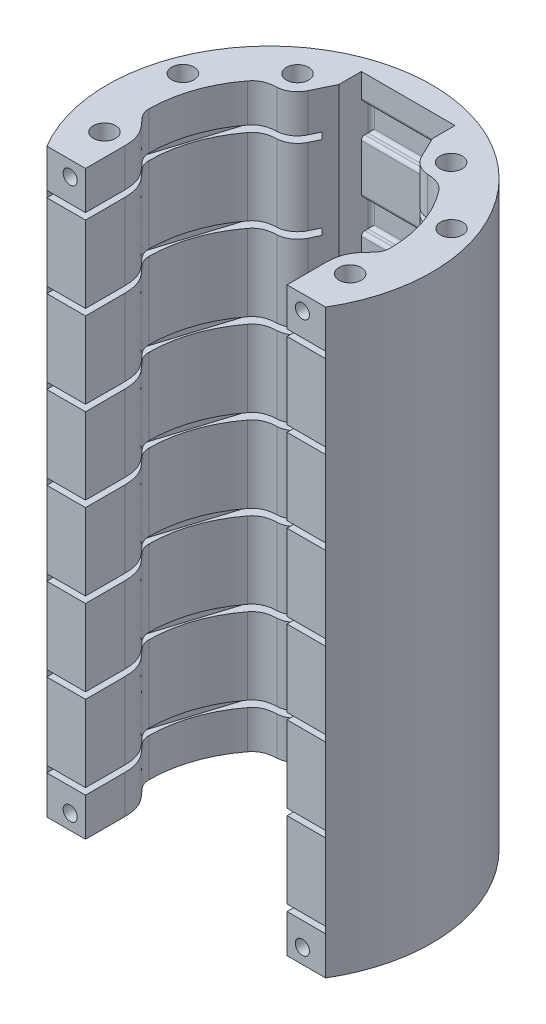
from build123d import *

# Parameters (mm, degrees)
SKETCH1_R               = 3.35
BOSS_EXTRUDE2_DEPTH     = 175
SLOT_DEPTH              = 0.975
SKETCH2_W               = 28.2
SKETCH2_H               = 9.048762348
CUT_EXTRUDE1_DEPTH      = 3
FILLET1_R               = 1
LPATTERN1_COUNT         = 7
LPATTERN1_PITCH         = 25
FILLET1_OF_LPATTERN1_R  = 1
SKETCH7_R               = 2.125
CUT_EXTRUDE2_DEPTH      = 8
MIRROR2_COPY_1_SKETCH_R = 2.125
MIRROR2_COPY_1_DEPTH    = 8


with BuildPart() as part:
    # Sketch1 → Boss-Extrude2 (new body)
    with BuildSketch(Plane(origin=(0, 0, 0), x_dir=(1, 0, 0), z_dir=(0, 1, 0))):
        with BuildLine():
            Line((-41.978758021, -25.07), (-30.348758021, -25.07))
            Line((-30.348758021, -25.07), (-30.348758021, -13.232808954))
            add(Edge.make_bspline(
                [(-30.348758021, -13.232808954), (-30.348758021, -4.818714921), (-36.33, -4.744134389), (-36.33, 0)],
                knots=[0, 0, 0, 0, 1, 1, 1, 1], degree=3))
            ThreePointArc((-36.33, 0), (-34.39042699, 11.711850043), (-28.778806418, 22.173163986))
            add(Edge.make_bspline(
                [(-28.778806418, 22.173163986), (-26.803037595, 24.859102931), (-22.681011433, 24.921676571)],
                knots=[0, 0, 0, 1, 1, 1], degree=2))
            ThreePointArc((-22.681011433, 24.921676571), (-19.402847958, 26.048993856), (-17.137442499, 28.672948531))
            Line((-17.137442499, 28.672948531), (-14.1, 34.984991814))
            Line((-14.1, 34.984991814), (-14.1, 41.76))
            Line((-14.1, 41.76), (14.1, 41.76))
            Line((14.1, 41.76), (14.1, 34.984991814))
            Line((14.1, 34.984991814), (17.137442499, 28.672948531))
            ThreePointArc((17.137442499, 28.672948531), (19.402847958, 26.048993856), (22.681011433, 24.921676571))
            add(Edge.make_bspline(
                [(28.778806418, 22.173163986), (26.803037595, 24.859102931), (22.681011433, 24.921676571)],
                knots=[0, 0, 0, 1, 1, 1], degree=2))
            ThreePointArc((28.778806418, 22.173163986), (34.39042699, 11.711850043), (36.33, 0))
            add(Edge.make_bspline(
                [(30.348758021, -13.232808954), (30.348758021, -4.818714921), (36.33, -4.744134389), (36.33, 0)],
                knots=[0, 0, 0, 0, 1, 1, 1, 1], degree=3))
            Line((30.348758021, -13.232808954), (30.348758021, -25.07))
            Line((30.348758021, -25.07), (41.978758021, -25.07))
            ThreePointArc((41.978758021, -25.07), (0, 48.895), (-41.978758021, -25.07))
        make_face()
        with Locations((-37.000474826, -12.718618748)):
            Circle(SKETCH1_R, mode=Mode.SUBTRACT)
        with Locations((37.000474826, -12.718618748)):
            Circle(SKETCH1_R, mode=Mode.SUBTRACT)
        with Locations((-40.457027923, 14.360145949)):
            Circle(SKETCH1_R, mode=Mode.SUBTRACT)
        with Locations((-23.129730363, 31.556520301)):
            Circle(SKETCH1_R, mode=Mode.SUBTRACT)
        with Locations((40.457027923, 14.360145949)):
            Circle(SKETCH1_R, mode=Mode.SUBTRACT)
        with Locations((23.129730363, 31.556520301)):
            Circle(SKETCH1_R, mode=Mode.SUBTRACT)
    extrude(amount=BOSS_EXTRUDE2_DEPTH)

    # Sketch6 → slot (cut, symmetric)
    with BuildSketch(Plane(origin=(0, 12.5, 0), x_dir=(-1, 0, 0), z_dir=(0, -1, 0))):
        with BuildLine():
            Line((41.978758021, -25.07), (42.348021617, -12.880616636))
            ThreePointArc((42.348021617, -12.880616636), (42.300596018, -11.989773536), (42.105800179, -11.119196027))
            Line((42.105800179, -11.119196027), (28.235055716, 33.155943022))
            ThreePointArc((28.235055716, 33.155943022), (24.341289072, 36.767530328), (19.253636812, 35.244120983))
            Line((19.253636812, 35.244120983), (13.047964359, 28.721243631))
            ThreePointArc((13.047964359, 28.721243631), (12.816725989, 28.560405037), (12.540811932, 28.50373344))
            Line((12.540811932, 28.50373344), (10.657647051, 28.50373344))
            ThreePointArc((10.657647051, 28.50373344), (10.516225695, 28.562312083), (10.457647051, 28.70373344))
            Line((10.457647051, 28.70373344), (10.457647051, 36.268969967))
            Line((10.457647051, 36.268969967), (9.766617018, 36.96))
            Line((9.766617018, 36.96), (-0.68191112, 36.96))
            Line((-0.68191112, 36.96), (-1.357647051, 36.284264069))
            Line((-1.357647051, 36.284264069), (-1.357647051, 29.218375638))
            ThreePointArc((-1.357647051, 29.218375638), (-2.007647051, 28.607259567), (-2.657647051, 29.218375638))
            Line((-2.657647051, 29.218375638), (-2.657647051, 36.284264069))
            Line((-2.657647051, 36.284264069), (-3.333382982, 36.96))
            Line((-3.333382982, 36.96), (-9.78191112, 36.96))
            Line((-9.78191112, 36.96), (-10.457647051, 36.284264069))
            Line((-10.457647051, 36.284264069), (-10.457647051, 28.70373344))
            ThreePointArc((-10.457647051, 28.70373344), (-10.516225695, 28.562312083), (-10.657647051, 28.50373344))
            Line((-10.657647051, 28.50373344), (-12.540811932, 28.50373344))
            ThreePointArc((-12.540811932, 28.50373344), (-12.816725989, 28.560405037), (-13.047964359, 28.721243631))
            Line((-13.047964359, 28.721243631), (-19.253636812, 35.244120983))
            ThreePointArc((-19.253636812, 35.244120983), (-24.341289072, 36.767530328), (-28.235055716, 33.155943022))
            Line((-28.235055716, 33.155943022), (-42.105800179, -11.119196027))
            ThreePointArc((-42.105800179, -11.119196027), (-42.300596018, -11.989773536), (-42.348021617, -12.880616636))
            Line((-42.348021617, -12.880616636), (-41.978758021, -25.07))
            Line((-41.978758021, -25.07), (41.978758021, -25.07))
        make_face()
    slot = extrude(amount=SLOT_DEPTH, both=True, mode=Mode.SUBTRACT)

    # Sketch2 → Cut-Extrude1 (cut)
    with BuildSketch(Plane.XY.offset(-41.76)):
        with Locations((0, 12.5)):
            Rectangle(SKETCH2_W, SKETCH2_H)
    cut_extrude1 = extrude(amount=-CUT_EXTRUDE1_DEPTH, mode=Mode.SUBTRACT)

    # Fillet1
    fillet1_edges = [part.edges().sort_by_distance(p)[0] for p in [
        (0, 17.024381174, -44.76),
        (14.1, 12.5, -44.76),
        (0, 7.975618826, -44.76),
        (-14.1, 12.5, -44.76),
        (0, 7.975618826, -41.76),
        (0, 17.024381174, -41.76),
    ]]
    fillet(fillet1_edges, radius=FILLET1_R)

    # LPattern1: slot, Cut-Extrude1 ×7
    with Locations(*[(0, i * LPATTERN1_PITCH, 0) for i in range(1, LPATTERN1_COUNT)]):
        add(slot, mode=Mode.SUBTRACT)
        add(cut_extrude1, mode=Mode.SUBTRACT)

    # Fillet1 of LPattern1
    fillet1_of_lpattern1_edges = [part.edges().sort_by_distance(p)[0] for p in [
        (0, 42.024381174, -44.76),
        (14.1, 37.5, -44.76),
        (0, 32.975618826, -44.76),
        (-14.1, 37.5, -44.76),
        (0, 32.975618826, -41.76),
        (0, 42.024381174, -41.76),
        (0, 67.024381174, -44.76),
        (14.1, 62.5, -44.76),
        (0, 57.975618826, -44.76),
        (-14.1, 62.5, -44.76),
        (0, 57.975618826, -41.76),
        (0, 67.024381174, -41.76),
        (0, 92.024381174, -44.76),
        (14.1, 87.5, -44.76),
        (0, 82.975618826, -44.76),
        (-14.1, 87.5, -44.76),
        (0, 82.975618826, -41.76),
        (0, 92.024381174, -41.76),
        (0, 117.024381174, -44.76),
        (14.1, 112.5, -44.76),
        (0, 107.975618826, -44.76),
        (-14.1, 112.5, -44.76),
        (0, 107.975618826, -41.76),
        (0, 117.024381174, -41.76),
        (0, 142.024381174, -44.76),
        (14.1, 137.5, -44.76),
        (0, 132.975618826, -44.76),
        (-14.1, 137.5, -44.76),
        (0, 132.975618826, -41.76),
        (0, 142.024381174, -41.76),
        (0, 167.024381174, -44.76),
        (14.1, 162.5, -44.76),
        (0, 157.975618826, -44.76),
        (-14.1, 162.5, -44.76),
        (0, 157.975618826, -41.76),
        (0, 167.024381174, -41.76),
    ]]
    fillet(fillet1_of_lpattern1_edges, radius=FILLET1_OF_LPATTERN1_R)

    # Sketch7 → Cut-Extrude2 (cut)
    with BuildSketch(Plane.XY.offset(25.07)):
        with Locations((34.962080117, 4.5125)):
            Circle(SKETCH7_R)
    cut_extrude2 = extrude(amount=-CUT_EXTRUDE2_DEPTH, mode=Mode.SUBTRACT)

    # Mirror1: Cut-Extrude2 across plane
    add(cut_extrude2.mirror(Plane(origin=(0, 0, 0), x_dir=(0, 0, 1), z_dir=(1, 0, 0))), mode=Mode.SUBTRACT)

    # Mirror2: Cut-Extrude2 across plane
    add(cut_extrude2.mirror(Plane(origin=(0, 87.5, 0), x_dir=(0, 0, 1), z_dir=(0, -1, 0))), mode=Mode.SUBTRACT)

    # Mirror2 copy 1 sketch → Mirror2 copy 1 (cut)
    with BuildSketch(Plane(origin=(0, 175, 25.07), x_dir=(-1, 0, 0), z_dir=(0, 0, 1))):
        with Locations((34.962080117, 4.5125)):
            Circle(MIRROR2_COPY_1_SKETCH_R)
    extrude(amount=-MIRROR2_COPY_1_DEPTH, mode=Mode.SUBTRACT)


solid = part.part
